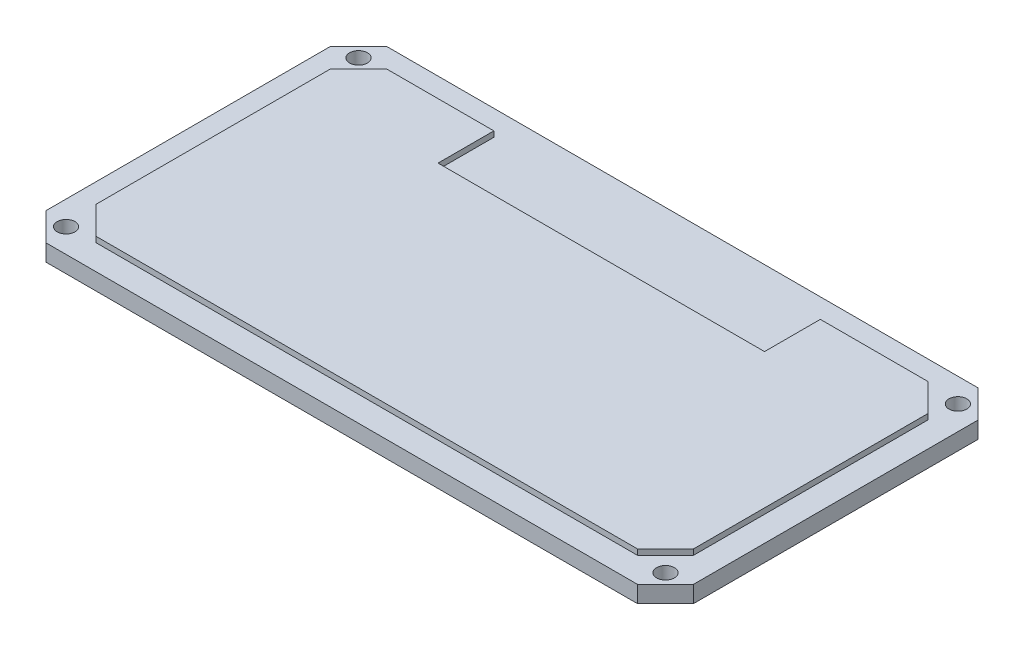
from build123d import *

# Parameters (mm, degrees)
SKETCH1_W           = 116
SKETCH1_H           = 61
BOSS_EXTRUDE1_DEPTH = 3
CHAMFER1_SIZE       = 5
SKETCH2_R           = 1.6
CUT_EXTRUDE1_DEPTH  = 10
SKETCH3_W           = 107
SKETCH3_H           = 52
BOSS_EXTRUDE2_DEPTH = 1
CHAMFER2_SIZE       = 5
SKETCH4_W           = 58.5
SKETCH4_H           = 10
CUT_EXTRUDE2_DEPTH  = 1


with BuildPart() as part:
    # Sketch1 → Boss-Extrude1 (new body)
    with BuildSketch(Plane(origin=(0, 0, 0), x_dir=(1, 0, 0), z_dir=(0, 1, 0))):
        Rectangle(SKETCH1_W, SKETCH1_H)
    extrude(amount=BOSS_EXTRUDE1_DEPTH)

    # Chamfer1
    chamfer1_edges = [part.edges().sort_by_distance(p)[0] for p in [
        (58, 1.5, 30.5),
        (-58, 1.5, 30.5),
        (-58, 1.5, -30.5),
        (58, 1.5, -30.5),
    ]]
    chamfer(chamfer1_edges, length=CHAMFER1_SIZE)

    # Sketch2 → Cut-Extrude1 (cut)
    with BuildSketch(Plane(origin=(0, 3, 0), x_dir=(1, 0, 0), z_dir=(0, 1, 0))):
        with Locations(Location((-53.7, 26.2, 0), (0, 0, 270))):
            Circle(SKETCH2_R)
        with Locations(Location((53.7, 26.2, 0), (0, 0, 270))):
            Circle(SKETCH2_R)
        with Locations(Location((53.7, -26.2, 0), (0, 0, 270))):
            Circle(SKETCH2_R)
        with Locations(Location((-53.7, -26.2, 0), (0, 0, 270))):
            Circle(SKETCH2_R)
    extrude(amount=-CUT_EXTRUDE1_DEPTH, mode=Mode.SUBTRACT)

    # Sketch3 → Boss-Extrude2 (add)
    with BuildSketch(Plane(origin=(0, 3, 0), x_dir=(1, 0, 0), z_dir=(0, 1, 0))):
        Rectangle(SKETCH3_W, SKETCH3_H)
    extrude(amount=BOSS_EXTRUDE2_DEPTH)

    # Chamfer2
    # the kernel refuses this chamfer: 5 mm, written as the material it takes off along each edge
    with BuildSketch(Plane(origin=(53.5, 3, 26), x_dir=(-0.9996219169112968, 0, 0.027495876610586317), z_dir=(0, 1, 0))) as chamfer2_piece_1:
        Polygon((CHAMFER2_SIZE * 0.999621916911, -CHAMFER2_SIZE * 0.0274958766106), (-CHAMFER2_SIZE * 0.0274958766106, -CHAMFER2_SIZE * 0.999621916911), (0, 0), align=None)
    extrude(amount=13.85841494, mode=Mode.SUBTRACT)
    with BuildSketch(Plane(origin=(53.5, 3, -26), x_dir=(-0.9996219169112968, 0, -0.027495876610586282), z_dir=(0, 1, 0)), Plane(origin=(-53.5, 3, -26), x_dir=(-0.027495876610586317, 0, 0.9996219169112968), z_dir=(0, 1, 0)), Plane(origin=(-53.5, 3, 26), x_dir=(0.9996219169112968, 0, 0.027495876610586282), z_dir=(0, 1, 0))) as chamfer2_piece_2:
        Polygon((CHAMFER2_SIZE * 0.999621916911, CHAMFER2_SIZE * 0.0274958766106), (-CHAMFER2_SIZE * 0.0274958766106, CHAMFER2_SIZE * 0.999621916911), (0, 0), align=None)
    extrude(amount=13.85841494, mode=Mode.SUBTRACT)

    # Sketch4 → Cut-Extrude2 (cut)
    with BuildSketch(Plane(origin=(0, 4, 0), x_dir=(1, 0, 0), z_dir=(0, 1, 0))):
        with Locations((0, 21)):
            Rectangle(SKETCH4_W, SKETCH4_H)
    extrude(amount=-CUT_EXTRUDE2_DEPTH, mode=Mode.SUBTRACT)


solid = part.part
